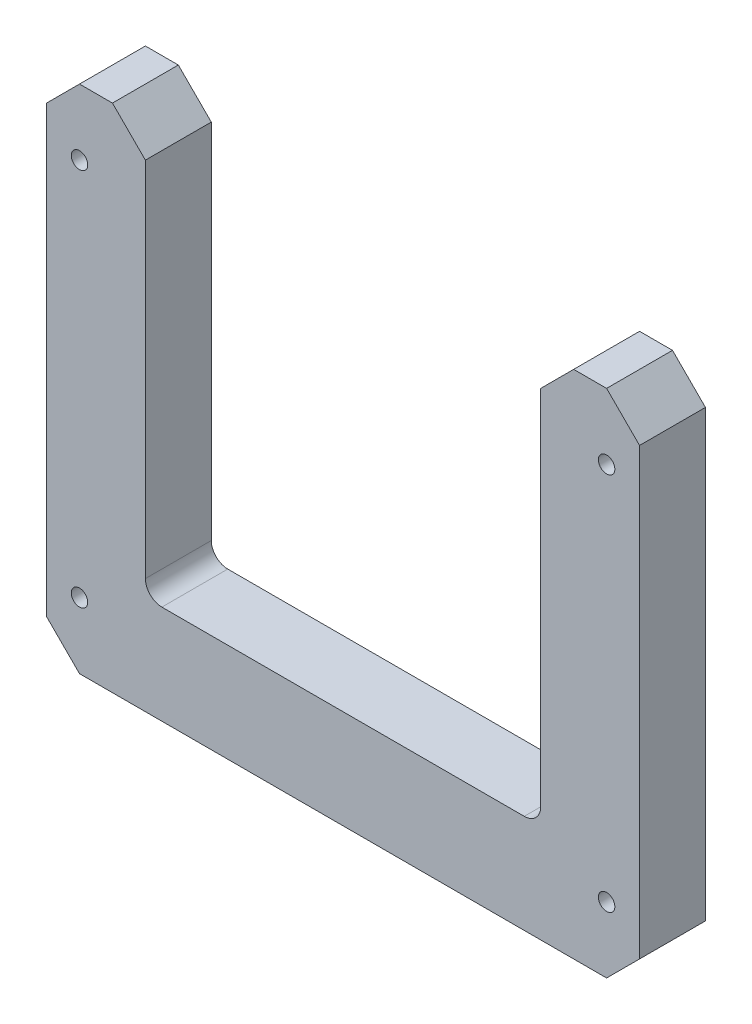
from build123d import *

# Parameters (mm, degrees)
BOSS_EXTRUDE1_DEPTH = 12.7
FILLET1_R           = 3.175
CHAMFER1_SIZE       = 6.35
HOLE1_D             = 3.175
HOLE1_DEPTH         = 31.75
HOLE1_CSINK_D       = 10.16
HOLE1_CSINK_ANGLE   = 82
HOLE1_TIP           = 0.953866233


with BuildPart() as part:
    # Sketch1 → Boss-Extrude1 (new body)
    with BuildSketch(Plane.XY):
        Polygon((-231.027465963, 69.04320968), (-231.027465963, -10.33179032), (-154.827465963, -10.33179032), (-154.827465963, 69.04320968), (-135.777465963, 69.04320968), (-135.777465963, -29.38179032), (-250.077465963, -29.38179032), (-250.077465963, 69.04320968), align=None)
    extrude(amount=BOSS_EXTRUDE1_DEPTH)

    # Fillet1
    fillet1_edges = [part.edges().sort_by_distance(p)[0] for p in [
        (-154.827465963, -10.33179032, 6.35),
        (-231.027465963, -10.33179032, 6.35),
    ]]
    fillet(fillet1_edges, radius=FILLET1_R)

    # Chamfer1
    chamfer1_edges = [part.edges().sort_by_distance(p)[0] for p in [
        (-250.077465963, -29.38179032, 6.35),
        (-135.777465963, -29.38179032, 6.35),
        (-135.777465963, 69.04320968, 6.35),
        (-154.827465963, 69.04320968, 6.35),
        (-250.077465963, 69.04320968, 6.35),
        (-231.027465963, 69.04320968, 6.35),
    ]]
    chamfer(chamfer1_edges, length=CHAMFER1_SIZE)

    # Hole1
    with Locations(Plane(origin=(-124.004465969, -215.287141225, -12.7), x_dir=(-1, 0, 0), z_dir=(0, 0, -1))):
        with Locations((113.649999994, 128.807623392), (113.649999994, 23.940956725), (-94.599999994, 161.374290059), (94.599999994, 161.374290059), (0, 161.374290059), (0, 193.124290059), (0, 440.553783621), (0, 301.970350905), (40.979166666, 301.970350905), (166.795833328, 301.970350905), (207.774999994, 440.553783621), (207.774999994, 333.02141023), (207.774999994, 225.48903684), (207.774999994, 137.424290059), (207.774999994, 10.424290059), (-207.774999994, 10.424290059), (-207.774999994, 137.424290059), (-207.774999994, 225.48903684), (-207.774999994, 333.02141023), (-207.774999994, 440.553783621), (-166.795833328, 301.970350905), (-40.979166666, 301.970350905), (-113.649999994, 23.940956725), (-113.649999994, 128.807623392), (119.722999994, 198.605350905), (119.722999994, 271.630350905), (18.122999994, 198.605350905), (18.122999994, 271.630350905)):
            CounterSinkHole(HOLE1_D / 2, HOLE1_CSINK_D / 2, depth=HOLE1_DEPTH, counter_sink_angle=HOLE1_CSINK_ANGLE)
            with Locations((0, 0, -(HOLE1_DEPTH + HOLE1_TIP / 2))):  # 118° drill point
                Cone(0, HOLE1_D / 2, HOLE1_TIP, mode=Mode.SUBTRACT)


solid = part.part
